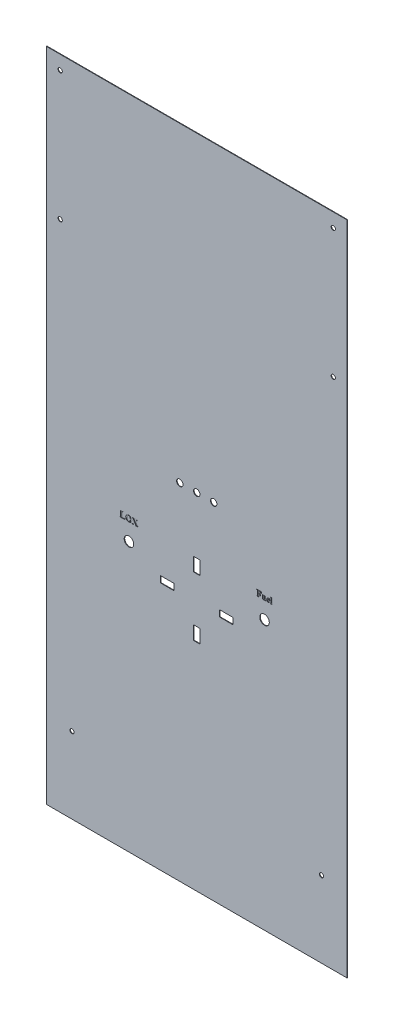
from build123d import *

# Parameters (mm, degrees)
SKETCH1_W           = 901.7
SKETCH1_H           = 1968.5
SKETCH1_R           = 6.35
BOSS_EXTRUDE1_DEPTH = 1.5875
SKETCH2_R           = 14.2875
SKETCH2_W           = 19.05
SKETCH2_H           = 40.64
SKETCH2_W_2         = 40.64
SKETCH2_H_2         = 19.05
CUT_EXTRUDE1_DEPTH  = 1083.597018819
WRAP1_START         = -3.81
WRAP1_DEPTH         = 1.27
SKETCH4_R           = 9.525
CUT_EXTRUDE4_DEPTH  = 22.86


# Read off the part's stored shape, not the designer's step: Wrap1
with BuildPart() as part:
    # Sketch1 → Boss-Extrude1 (new body)
    with BuildSketch(Plane.XY):
        Rectangle(SKETCH1_W, SKETCH1_H)
        with Locations((-409.447415534, 942.65240495)):
            Circle(SKETCH1_R, mode=Mode.SUBTRACT)
        with Locations((-409.447415534, 555.94759505)):
            Circle(SKETCH1_R, mode=Mode.SUBTRACT)
        with Locations((-374.018387972, -755.65)):
            Circle(SKETCH1_R, mode=Mode.SUBTRACT)
        with Locations(Location((374.018387972, -755.65, 0), (0, 0, 180))):
            Circle(SKETCH1_R, mode=Mode.SUBTRACT)
        with Locations(Location((409.447415534, 555.94759505, 0), (0, 0, 180))):
            Circle(SKETCH1_R, mode=Mode.SUBTRACT)
        with Locations(Location((409.447415534, 942.65240495, 0), (0, 0, 180))):
            Circle(SKETCH1_R, mode=Mode.SUBTRACT)
    extrude(amount=BOSS_EXTRUDE1_DEPTH)

    # Sketch2 → Cut-Extrude1 (cut, through all)
    with BuildSketch(Plane(origin=(0, 0, 0), x_dir=(-1, 0, 0), z_dir=(0, 0, -1))):
        with Locations((203.2, -177.8)):
            Circle(SKETCH2_R)
        with Locations((-203.2, -177.8)):
            Circle(SKETCH2_R)
        with Locations((0, -139.7)):
            Rectangle(SKETCH2_W, SKETCH2_H)
        with Locations((-88.9, -228.6)):
            Rectangle(SKETCH2_W_2, SKETCH2_H_2)
        with Locations((88.9, -228.6)):
            Rectangle(SKETCH2_W_2, SKETCH2_H_2)
        with Locations((0, -317.5)):
            Rectangle(SKETCH2_W, SKETCH2_H)
    extrude(amount=-CUT_EXTRUDE1_DEPTH, mode=Mode.SUBTRACT)

    # Wrap1 outline → Wrap1 (cut)
    # profile 1 of 7: a face of its own
    with BuildSketch(Plane.XY.offset(4.1275).offset(WRAP1_START)):
        with BuildLine():
            add(Edge.make_bspline(
                [(-229.753426043, -126.522165256), (-229.636237529, -126.519976219), (-229.41317649, -126.515809523), (-229.09617467, -126.466288885), (-228.813209456, -126.387863271), (-228.646163395, -126.304456099), (-228.566305351, -126.264582464)],
                knots=[0, 0, 0, 0, 0.286116983, 0.54460586, 0.782294265, 1, 1, 1, 1], degree=3))
            Line((-229.753426043, -126.522165256), (-230.317121718, -126.522165256))
            Line((-230.317121718, -126.522165256), (-230.317121718, -127))
            Line((-230.317121718, -127), (-215.265327284, -127))
            Line((-215.265327284, -127), (-214.548575168, -120.788148329))
            Line((-214.548575168, -120.788148329), (-215.026409912, -120.788148329))
            add(Edge.make_bspline(
                [(-220.151934157, -125.80541314), (-219.932562836, -125.800281899), (-219.510508502, -125.790409766), (-218.907320259, -125.698872442), (-218.358302074, -125.557162613), (-217.864370172, -125.344330626), (-217.414474169, -125.065851051), (-217.002301016, -124.717785385), (-216.620132883, -124.304052356), (-216.331879217, -123.906660058), (-216.11791995, -123.547865792), (-215.951997015, -123.245314942), (-215.794334863, -122.908249637), (-215.632393068, -122.54506771), (-215.481375396, -122.148092083), (-215.322503972, -121.724083219), (-215.171391707, -121.266497406), (-215.07550252, -120.950123175), (-215.026409912, -120.788148329)],
                knots=[0, 0, 0, 0, 0.083692486, 0.161018205, 0.232346257, 0.299586786, 0.365500353, 0.433621102, 0.504882686, 0.580041871, 0.620531465, 0.664319798, 0.71170201, 0.762539634, 0.816086004, 0.873798358, 0.935388254, 1, 1, 1, 1], degree=3))
            Line((-220.151934157, -125.80541314), (-221.585438389, -125.80541314))
            add(Edge.make_bspline(
                [(-223.119735887, -125.693420622), (-223.047852608, -125.711296101), (-222.870193417, -125.755475265), (-222.540067551, -125.779019781), (-222.101040503, -125.803347996), (-221.769696871, -125.804675129), (-221.585438389, -125.80541314)],
                knots=[0, 0, 0, 0, 0.143896066, 0.355638461, 0.641673878, 1, 1, 1, 1], degree=3))
            add(Edge.make_bspline(
                [(-223.866352675, -123.498367267), (-223.865392, -123.601652345), (-223.863551432, -123.799537588), (-223.856493191, -124.080826647), (-223.844815466, -124.333432834), (-223.832218453, -124.555332016), (-223.808811963, -124.748212218), (-223.783249281, -124.91138468), (-223.756011668, -125.047332218), (-223.70606115, -125.185917292), (-223.625445227, -125.332812904), (-223.491822327, -125.481418383), (-223.318626353, -125.601331533), (-223.187975318, -125.661824804), (-223.119735887, -125.693420622)],
                knots=[0, 0, 0, 0, 0.124219593, 0.237993955, 0.338360787, 0.42835088, 0.505199409, 0.571874059, 0.627062731, 0.671557261, 0.748594982, 0.82701569, 0.909649771, 1, 1, 1, 1], degree=3))
            Line((-223.866352675, -123.498367267), (-223.866352675, -112.664957682))
            add(Edge.make_bspline(
                [(-223.739427821, -111.119460932), (-223.749999809, -111.149146381), (-223.773852692, -111.216123714), (-223.798505966, -111.335239557), (-223.821268807, -111.483376173), (-223.833059635, -111.663254918), (-223.849289377, -111.87085995), (-223.861102616, -112.108602576), (-223.862236444, -112.376276017), (-223.864933293, -112.565412846), (-223.866352675, -112.664957682)],
                knots=[0, 0, 0, 0, 0.06067886, 0.136905735, 0.233920776, 0.349449884, 0.48411048, 0.635389887, 0.808101606, 1, 1, 1, 1], degree=3))
            add(Edge.make_bspline(
                [(-223.261593077, -110.533366754), (-223.310259198, -110.565232512), (-223.409867386, -110.630454278), (-223.538040862, -110.765996793), (-223.649286752, -110.930935983), (-223.708665918, -111.055124151), (-223.739427821, -111.119460932)],
                knots=[0, 0, 0, 0, 0.226387342, 0.463362038, 0.721989949, 1, 1, 1, 1], degree=3))
            add(Edge.make_bspline(
                [(-222.160333316, -110.275783963), (-222.268802824, -110.278119635), (-222.476986966, -110.28260246), (-222.772042924, -110.330870623), (-223.035001757, -110.410815629), (-223.188015126, -110.493572376), (-223.261593077, -110.533366754)],
                knots=[0, 0, 0, 0, 0.284002636, 0.54508263, 0.781248603, 1, 1, 1, 1], degree=3))
            Line((-222.160333316, -110.275783963), (-221.477178955, -110.275783963))
            Line((-221.477178955, -110.275783963), (-221.477178955, -109.797949219))
            Line((-221.477178955, -109.797949219), (-230.317121718, -109.797949219))
            Line((-230.317121718, -109.797949219), (-230.317121718, -110.275783963))
            Line((-230.317121718, -110.275783963), (-229.753426043, -110.275783963))
            add(Edge.make_bspline(
                [(-227.927947998, -112.664957682), (-227.929376487, -112.564168786), (-227.932110034, -112.371299754), (-227.933119221, -112.09740266), (-227.945249249, -111.853456485), (-227.960174603, -111.640682081), (-227.976466296, -111.455801376), (-228.004528872, -111.302130434), (-228.026816696, -111.175687487), (-228.073793401, -111.049072991), (-228.148610431, -110.910709437), (-228.275397871, -110.764872143), (-228.434574129, -110.630147904), (-228.626451322, -110.505917808), (-228.855303867, -110.400345023), (-229.122678716, -110.328270983), (-229.42585248, -110.282806886), (-229.64000416, -110.27821564), (-229.753426043, -110.275783963)],
                knots=[0, 0, 0, 0, 0.084622749, 0.161933587, 0.22990784, 0.289599081, 0.34105252, 0.385532842, 0.420773186, 0.448530112, 0.498553263, 0.551922288, 0.609709232, 0.67316662, 0.743282504, 0.820338844, 0.90484545, 1, 1, 1, 1], degree=3))
            Line((-227.927947998, -112.664957682), (-227.927947998, -124.132991536))
            add(Edge.make_bspline(
                [(-228.066072104, -125.678488286), (-228.053878904, -125.648919223), (-228.026103286, -125.581562086), (-228.005452117, -125.460770969), (-227.975507496, -125.313738641), (-227.960396653, -125.134824087), (-227.945152957, -124.925847451), (-227.933270797, -124.688097364), (-227.932024686, -124.420430161), (-227.929359829, -124.232536736), (-227.927947998, -124.132991536)],
                knots=[0, 0, 0, 0, 0.061394352, 0.139853863, 0.234760276, 0.350352995, 0.484827155, 0.638289672, 0.808367287, 1, 1, 1, 1], degree=3))
            add(Edge.make_bspline(
                [(-228.566305351, -126.264582464), (-228.513841635, -126.232933684), (-228.407719614, -126.168915485), (-228.271425976, -126.033307564), (-228.155927585, -125.868003182), (-228.096632758, -125.742944001), (-228.066072104, -125.678488286)],
                knots=[0, 0, 0, 0, 0.23335888, 0.472031298, 0.72788403, 1, 1, 1, 1], degree=3))
        make_face()
    # profile 2 of 7: a face of its own
    with BuildSketch(Plane.XY.offset(4.1275).offset(WRAP1_START)):
        with BuildLine():
            add(Edge.make_bspline(
                [(-194.718433295, -118.260850504), (-194.724017479, -118.527395433), (-194.735035576, -119.053312496), (-194.827203283, -119.829949656), (-194.977372559, -120.582130209), (-195.180608052, -121.312966858), (-195.451068619, -122.017123582), (-195.783231756, -122.69419378), (-196.164460973, -123.35329381), (-196.468850095, -123.762458061), (-196.622306103, -123.968735843)],
                knots=[0, 0, 0, 0, 0.130405832, 0.257302407, 0.382101033, 0.505478704, 0.628069418, 0.750625341, 0.874279213, 1, 1, 1, 1], degree=3))
            add(Edge.make_bspline(
                [(-203.909285948, -109.559031847), (-203.576856146, -109.553848597), (-202.926775912, -109.543712539), (-201.973128758, -109.637324107), (-201.066575694, -109.807149904), (-200.206609472, -110.059482945), (-199.398043873, -110.403407626), (-198.634697098, -110.827047087), (-197.919622082, -111.336565182), (-197.261501448, -111.926383685), (-196.66864867, -112.576115942), (-196.145231314, -113.269846968), (-195.70250353, -114.003776103), (-195.342394477, -114.778877827), (-195.06002235, -115.592766401), (-194.864971074, -116.447883307), (-194.741519452, -117.341405333), (-194.726223502, -117.950592369), (-194.718433295, -118.260850504)],
                knots=[0, 0, 0, 0, 0.069849949, 0.136594465, 0.20103729, 0.263531056, 0.324607527, 0.385387455, 0.446727247, 0.508796852, 0.570828957, 0.631365177, 0.691215795, 0.75067175, 0.810735822, 0.87197288, 0.934795961, 1, 1, 1, 1], degree=3))
            add(Edge.make_bspline(
                [(-212.876153564, -118.272049756), (-212.868157043, -117.961837627), (-212.852455997, -117.352740923), (-212.731856278, -116.457996138), (-212.525783502, -115.604326355), (-212.240446011, -114.788989394), (-211.87789791, -114.011937584), (-211.430577993, -113.276279528), (-210.899609784, -112.582201243), (-210.294740021, -111.934406847), (-209.633428736, -111.3455359), (-208.927659924, -110.831424373), (-208.1808215, -110.409611212), (-207.398487794, -110.06609697), (-206.578639267, -109.807869114), (-205.720070019, -109.63766039), (-204.82597401, -109.543972597), (-204.218086037, -109.553958913), (-203.909285948, -109.559031847)],
                knots=[0, 0, 0, 0, 0.066265956, 0.130112177, 0.192469093, 0.253598737, 0.314376421, 0.375339326, 0.437182314, 0.500765603, 0.564420002, 0.626110784, 0.686953563, 0.747315202, 0.808362113, 0.870201672, 0.934063944, 1, 1, 1, 1], degree=3))
            add(Edge.make_bspline(
                [(-210.882686742, -124.121792285), (-211.041964948, -123.914138898), (-211.358752432, -123.501138302), (-211.765029578, -122.838579483), (-212.106515122, -122.146758921), (-212.387202635, -121.427235156), (-212.608287484, -120.679395853), (-212.764464604, -119.902462731), (-212.860479239, -119.097003096), (-212.870876009, -118.549812049), (-212.876153564, -118.272049756)],
                knots=[0, 0, 0, 0, 0.124469297, 0.247556251, 0.369105337, 0.491161059, 0.614633392, 0.73970266, 0.867869208, 1, 1, 1, 1], degree=3))
            add(Edge.make_bspline(
                [(-203.745030255, -127.238917372), (-203.934245051, -127.237184516), (-204.308079424, -127.233760888), (-204.860990224, -127.193963899), (-205.39821356, -127.136256498), (-205.919316031, -127.05062999), (-206.422649041, -126.9359105), (-206.913431242, -126.809580948), (-207.38332404, -126.64672569), (-207.83756508, -126.462373568), (-208.278052534, -126.25912154), (-208.700899992, -126.027151484), (-209.104515854, -125.767855886), (-209.493225434, -125.487366165), (-209.868142157, -125.18574585), (-210.223166586, -124.854873643), (-210.563395068, -124.500787124), (-210.775787893, -124.248679752), (-210.882686742, -124.121792285)],
                knots=[0, 0, 0, 0, 0.070311969, 0.138916362, 0.205924571, 0.271084613, 0.335043637, 0.397754782, 0.459328336, 0.519703925, 0.579914551, 0.639525377, 0.698797951, 0.758099388, 0.817616847, 0.877506899, 0.938348334, 1, 1, 1, 1], degree=3))
            add(Edge.make_bspline(
                [(-196.622306103, -123.968735843), (-196.728949032, -124.102023109), (-196.940164733, -124.366010264), (-197.283101614, -124.734937967), (-197.635197756, -125.084869872), (-198.011845907, -125.40091671), (-198.399119001, -125.697042327), (-198.803860249, -125.967274303), (-199.225970337, -126.209236136), (-199.663398873, -126.426575744), (-200.117876159, -126.616624885), (-200.586542788, -126.786275217), (-201.075280584, -126.922569372), (-201.578199328, -127.039072591), (-202.097972362, -127.128677976), (-202.632721999, -127.190039728), (-203.183066067, -127.234871185), (-203.555792531, -127.237554845), (-203.745030255, -127.238917372)],
                knots=[0, 0, 0, 0, 0.062892078, 0.124563294, 0.185534769, 0.245726785, 0.305624548, 0.365154215, 0.424941259, 0.484831998, 0.54505371, 0.606415486, 0.668404777, 0.731930775, 0.796623147, 0.862668568, 0.930275174, 1, 1, 1, 1], degree=3))
        make_face()
        with BuildLine():
            add(Edge.make_bspline(
                [(-207.336257002, -112.877743467), (-207.418011601, -113.046803464), (-207.587222221, -113.396713404), (-207.782425416, -113.966883133), (-207.955597854, -114.586083402), (-208.096394776, -115.258230894), (-208.202657758, -115.983986359), (-208.279731821, -116.761310103), (-208.329848235, -117.590726366), (-208.334386685, -118.161225378), (-208.336723497, -118.454970868)],
                knots=[0, 0, 0, 0, 0.098492955, 0.203854633, 0.315738249, 0.435901004, 0.564024753, 0.700575662, 0.845828744, 1, 1, 1, 1], degree=3))
            add(Edge.make_bspline(
                [(-203.759962591, -110.514701335), (-203.950981852, -110.521329236), (-204.32403358, -110.534273219), (-204.864161608, -110.651635695), (-205.370511851, -110.832833113), (-205.839443614, -111.097103002), (-206.275888465, -111.429981496), (-206.669491416, -111.845337128), (-207.030434857, -112.329324537), (-207.232117168, -112.690993562), (-207.336257002, -112.877743467)],
                knots=[0, 0, 0, 0, 0.126292685, 0.246643735, 0.364165419, 0.481050344, 0.601480292, 0.726142767, 0.858592225, 1, 1, 1, 1], degree=3))
            add(Edge.make_bspline(
                [(-199.257863363, -118.555764135), (-199.260150236, -118.28570862), (-199.264577899, -117.762848584), (-199.294598316, -117.004720651), (-199.342354753, -116.298778745), (-199.408046938, -115.644744856), (-199.495249504, -115.0437181), (-199.610124055, -114.49664799), (-199.731670696, -113.999601347), (-199.883973099, -113.55448585), (-200.051568333, -113.153189474), (-200.220491672, -112.780337458), (-200.40937288, -112.442418253), (-200.600277353, -112.129008589), (-200.81201909, -111.85395378), (-201.027892107, -111.603286144), (-201.259982249, -111.387840569), (-201.578216058, -111.139023945), (-202.003960149, -110.884710985), (-202.557457648, -110.672459309), (-203.145997012, -110.53477257), (-203.552612772, -110.521479837), (-203.759962591, -110.514701335)],
                knots=[0, 0, 0, 0, 0.078235768, 0.15147388, 0.219769184, 0.283189358, 0.341871029, 0.39560353, 0.44509179, 0.490008293, 0.531715711, 0.571069594, 0.608500784, 0.643809453, 0.677264075, 0.708938794, 0.739545141, 0.768823346, 0.825888193, 0.882390021, 0.940025916, 1, 1, 1, 1], degree=3))
            add(Edge.make_bspline(
                [(-201.609706243, -125.659822867), (-201.518910442, -125.590370406), (-201.334389107, -125.449224443), (-201.075831196, -125.206206225), (-200.838968032, -124.92773117), (-200.61305054, -124.624253287), (-200.404645933, -124.290370142), (-200.209378265, -123.928329827), (-200.036400501, -123.533280409), (-199.869397069, -123.111498101), (-199.726283579, -122.655643678), (-199.596770806, -122.168011215), (-199.496883696, -121.645799464), (-199.404119426, -121.092516696), (-199.339843069, -120.505377496), (-199.289895411, -119.885502452), (-199.266084208, -119.231633965), (-199.260648465, -118.784738968), (-199.257863363, -118.555764135)],
                knots=[0, 0, 0, 0, 0.044242423, 0.089912429, 0.137048047, 0.185612229, 0.236272384, 0.289296534, 0.344719967, 0.403142498, 0.464849718, 0.529587621, 0.598372434, 0.670607157, 0.746741958, 0.826962138, 0.911340884, 1, 1, 1, 1], degree=3))
            add(Edge.make_bspline(
                [(-203.786094178, -126.283247884), (-203.577534203, -126.277488771), (-203.174112894, -126.266348815), (-202.597987697, -126.140658338), (-202.068139274, -125.953526382), (-201.760935203, -125.756710469), (-201.609706243, -125.659822867)],
                knots=[0, 0, 0, 0, 0.271629072, 0.525416998, 0.766374536, 1, 1, 1, 1], degree=3))
            add(Edge.make_bspline(
                [(-206.794959831, -124.838544401), (-206.703104717, -124.954220234), (-206.52357018, -125.180313328), (-206.21090486, -125.474389772), (-205.875288692, -125.728431585), (-205.505384156, -125.927398468), (-205.115500528, -126.09224697), (-204.695677531, -126.202467996), (-204.250044979, -126.271235548), (-203.943147012, -126.279181566), (-203.786094178, -126.283247884)],
                knots=[0, 0, 0, 0, 0.12750736, 0.249218294, 0.369884192, 0.490218952, 0.611248533, 0.734906211, 0.864340154, 1, 1, 1, 1], degree=3))
            add(Edge.make_bspline(
                [(-208.336723497, -118.454970868), (-208.333476883, -118.803555521), (-208.327195784, -119.477948657), (-208.249358748, -120.453508534), (-208.133703357, -121.359168115), (-207.967016958, -122.194241479), (-207.751395889, -122.960169556), (-207.48801407, -123.655909283), (-207.176706047, -124.284764584), (-206.920066783, -124.657058109), (-206.794959831, -124.838544401)],
                knots=[0, 0, 0, 0, 0.156670188, 0.303103704, 0.439658844, 0.566921389, 0.685563365, 0.796936138, 0.901010077, 1, 1, 1, 1], degree=3))
        make_face(mode=Mode.SUBTRACT)
    # profile 3 of 7: a face of its own
    with BuildSketch(Plane.XY.offset(4.1275).offset(WRAP1_START)):
        with BuildLine():
            add(Edge.make_bspline(
                [(-178.315262477, -123.901540332), (-178.220954099, -124.042332192), (-178.040973638, -124.311022891), (-177.780417607, -124.691101697), (-177.542567801, -125.028886613), (-177.321117656, -125.319631326), (-177.124841845, -125.569878388), (-176.950043375, -125.777286062), (-176.794414717, -125.938631232), (-176.614360473, -126.095060742), (-176.388000485, -126.240639613), (-176.102705495, -126.377493649), (-175.792360898, -126.470692124), (-175.576923504, -126.504766569), (-175.466919433, -126.522165256)],
                knots=[0, 0, 0, 0, 0.126497608, 0.241411193, 0.343994715, 0.434841881, 0.514196246, 0.581398797, 0.637233328, 0.681363404, 0.759169511, 0.837285515, 0.916916671, 1, 1, 1, 1], degree=3))
            Line((-178.315262477, -123.901540332), (-182.847226376, -117.058797476))
            Line((-182.847226376, -117.058797476), (-179.67410503, -113.116660839))
            add(Edge.make_bspline(
                [(-178.035281181, -111.138126352), (-178.067911162, -111.171467294), (-178.144929118, -111.250163361), (-178.270668934, -111.394301992), (-178.43270684, -111.576080202), (-178.621005906, -111.804397521), (-178.841537657, -112.072940804), (-179.091408658, -112.383005643), (-179.372355461, -112.735384894), (-179.569662217, -112.984692027), (-179.67410503, -113.116660839)],
                knots=[0, 0, 0, 0, 0.054447391, 0.128514533, 0.223210912, 0.338706703, 0.473921181, 0.62886415, 0.803542095, 1, 1, 1, 1], degree=3))
            add(Edge.make_bspline(
                [(-175.870092498, -110.275783963), (-175.988388839, -110.28054247), (-176.213111938, -110.289582027), (-176.53193173, -110.325021943), (-176.814061909, -110.385280788), (-177.069543497, -110.463935091), (-177.309766105, -110.576399345), (-177.5452197, -110.730779986), (-177.792284414, -110.916455595), (-177.951864525, -111.062030552), (-178.035281181, -111.138126352)],
                knots=[0, 0, 0, 0, 0.147897503, 0.280955311, 0.400178886, 0.507855505, 0.614267687, 0.73028563, 0.859013314, 1, 1, 1, 1], degree=3))
            Line((-175.870092498, -110.275783963), (-175.870092498, -109.797949219))
            Line((-175.870092498, -109.797949219), (-182.283530702, -109.797949219))
            Line((-182.283530702, -109.797949219), (-182.283530702, -110.275783963))
            add(Edge.make_bspline(
                [(-180.394590229, -111.526367082), (-180.403774393, -111.415123672), (-180.422240277, -111.191455202), (-180.57988662, -110.882221614), (-180.818105816, -110.61362874), (-181.096798512, -110.451322452), (-181.369936212, -110.360529529), (-181.630665232, -110.309534589), (-181.94074642, -110.282292916), (-182.16401731, -110.278053341), (-182.283530702, -110.275783963)],
                knots=[0, 0, 0, 0, 0.130173209, 0.261729146, 0.399541564, 0.547861549, 0.634397953, 0.737427191, 0.859448911, 1, 1, 1, 1], degree=3))
            add(Edge.make_bspline(
                [(-181.77956437, -113.919273885), (-181.670165064, -113.783270081), (-181.462006767, -113.524490375), (-181.183403562, -113.142693233), (-180.942598204, -112.797280643), (-180.746913136, -112.482078866), (-180.592210352, -112.200149806), (-180.481139557, -111.948754979), (-180.412179484, -111.727798585), (-180.400053988, -111.588937844), (-180.394590229, -111.526367082)],
                knots=[0, 0, 0, 0, 0.187080214, 0.355964768, 0.50655841, 0.638342089, 0.753533152, 0.850920003, 0.932824433, 1, 1, 1, 1], degree=3))
            Line((-181.77956437, -113.919273885), (-183.504249149, -116.062064065))
            Line((-183.504249149, -116.062064065), (-185.609708489, -112.885209635))
            Line((-185.609708489, -112.885209635), (-186.479517047, -111.574897173))
            add(Edge.make_bspline(
                [(-186.565377977, -111.093329345), (-186.562378123, -111.181261317), (-186.556756568, -111.34604082), (-186.504082454, -111.502111254), (-186.479517047, -111.574897173)],
                knots=[0, 0, 0, 0, 0.533634166, 1, 1, 1, 1], degree=3))
            add(Edge.make_bspline(
                [(-185.258798599, -110.275783963), (-185.37104042, -110.27798624), (-185.579143812, -110.282069401), (-185.863294114, -110.327280866), (-186.098857514, -110.391690812), (-186.275812465, -110.500759486), (-186.407129066, -110.626867808), (-186.500166643, -110.768269442), (-186.554446759, -110.926544536), (-186.561681095, -111.036923576), (-186.565377977, -111.093329345)],
                knots=[0, 0, 0, 0, 0.193798871, 0.359315288, 0.49675642, 0.612601935, 0.714528736, 0.809401167, 0.902600404, 1, 1, 1, 1], degree=3))
            Line((-185.258798599, -110.275783963), (-184.829493946, -110.275783963))
            Line((-184.829493946, -110.275783963), (-184.829493946, -109.797949219))
            Line((-184.829493946, -109.797949219), (-193.221466637, -109.797949219))
            Line((-193.221466637, -109.797949219), (-193.221466637, -110.275783963))
            add(Edge.make_bspline(
                [(-191.646105215, -111.134393268), (-191.700723502, -111.068399346), (-191.804776639, -110.94267452), (-191.976203892, -110.781825301), (-192.140999932, -110.645457869), (-192.314779915, -110.541253063), (-192.499368964, -110.450303007), (-192.714520602, -110.384128408), (-192.956368151, -110.317695745), (-193.130245394, -110.290205942), (-193.221466637, -110.275783963)],
                knots=[0, 0, 0, 0, 0.138951375, 0.264715855, 0.381158651, 0.485468856, 0.593016643, 0.714420306, 0.850176286, 1, 1, 1, 1], degree=3))
            add(Edge.make_bspline(
                [(-190.425386768, -112.892675802), (-190.510008736, -112.76824351), (-190.66916105, -112.53421814), (-190.893644324, -112.203950584), (-191.090125143, -111.919755069), (-191.2558718, -111.677666631), (-191.393563225, -111.479483765), (-191.504256651, -111.326045529), (-191.583346182, -111.213936229), (-191.628526414, -111.156673246), (-191.646105215, -111.134393268)],
                knots=[0, 0, 0, 0, 0.210884309, 0.396619539, 0.559630646, 0.695069056, 0.807787606, 0.897795021, 0.960233914, 1, 1, 1, 1], degree=3))
            Line((-190.425386768, -112.892675802), (-186.15100566, -119.347177929))
            Line((-186.15100566, -119.347177929), (-189.484649616, -123.487168015))
            add(Edge.make_bspline(
                [(-191.84022558, -125.913672574), (-191.766050175, -125.859885825), (-191.606062475, -125.743874079), (-191.366058271, -125.535878004), (-191.099990605, -125.294138782), (-190.816694507, -125.0094193), (-190.515967961, -124.681894349), (-190.185947113, -124.322032296), (-189.840526286, -123.918365216), (-189.606143705, -123.634376066), (-189.484649616, -123.487168015)],
                knots=[0, 0, 0, 0, 0.081036263, 0.17478577, 0.280771193, 0.39911038, 0.529989712, 0.674191297, 0.831114449, 1, 1, 1, 1], degree=3))
            add(Edge.make_bspline(
                [(-193.605974282, -126.522165256), (-193.428475542, -126.492064393), (-193.090058547, -126.434674445), (-192.617066321, -126.297633403), (-192.196800775, -126.137494655), (-191.955258099, -125.985878432), (-191.84022558, -125.913672574)],
                knots=[0, 0, 0, 0, 0.286640828, 0.546506005, 0.784027577, 1, 1, 1, 1], degree=3))
            Line((-193.605974282, -126.522165256), (-193.605974282, -127))
            Line((-193.605974282, -127), (-186.901355531, -127))
            Line((-186.901355531, -127), (-186.901355531, -126.522165256))
            add(Edge.make_bspline(
                [(-187.983949873, -126.451236661), (-187.92808433, -126.462106428), (-187.794865981, -126.488026741), (-187.557390939, -126.506108324), (-187.252494845, -126.5219491), (-187.025831792, -126.52208863), (-186.901355531, -126.522165256)],
                knots=[0, 0, 0, 0, 0.157013586, 0.374418457, 0.65645018, 1, 1, 1, 1], degree=3))
            add(Edge.make_bspline(
                [(-189.182269817, -125.357443068), (-189.178851806, -125.416422899), (-189.172072093, -125.53341092), (-189.110462365, -125.705148863), (-189.013051414, -125.867543086), (-188.879299513, -126.022595825), (-188.710655866, -126.166853091), (-188.499640293, -126.282553785), (-188.255487944, -126.382385117), (-188.078006956, -126.427387426), (-187.983949873, -126.451236661)],
                knots=[0, 0, 0, 0, 0.100751351, 0.199842915, 0.30878505, 0.423694858, 0.549243335, 0.686728538, 0.833979966, 1, 1, 1, 1], degree=3))
            add(Edge.make_bspline(
                [(-188.010081461, -123.468502596), (-188.103204143, -123.578415982), (-188.279522639, -123.786526001), (-188.514294387, -124.09516081), (-188.716886225, -124.372651741), (-188.880348063, -124.624214005), (-189.016057474, -124.842408939), (-189.104691846, -125.038941749), (-189.167747871, -125.205610863), (-189.177829475, -125.311017685), (-189.182269817, -125.357443068)],
                knots=[0, 0, 0, 0, 0.192150646, 0.363818055, 0.517241748, 0.650310056, 0.764194402, 0.859271298, 0.938017447, 1, 1, 1, 1], degree=3))
            Line((-188.010081461, -123.468502596), (-185.493982887, -120.340178257))
            Line((-185.493982887, -120.340178257), (-183.175737762, -123.841810989))
            add(Edge.make_bspline(
                [(-182.294729953, -125.256649801), (-182.333521799, -125.178930532), (-182.426187099, -124.993276065), (-182.619758612, -124.684435407), (-182.871831428, -124.288855042), (-183.067842083, -124.000524766), (-183.175737762, -123.841810989)],
                knots=[0, 0, 0, 0, 0.156153027, 0.373015693, 0.654871322, 1, 1, 1, 1], degree=3))
            add(Edge.make_bspline(
                [(-182.208869023, -125.663555951), (-182.212308373, -125.590514532), (-182.218918647, -125.450132254), (-182.270153016, -125.319374036), (-182.294729953, -125.256649801)],
                knots=[0, 0, 0, 0, 0.520303695, 1, 1, 1, 1], degree=3))
            add(Edge.make_bspline(
                [(-183.78049736, -126.522165256), (-183.62973452, -126.507746945), (-183.3557518, -126.481544413), (-182.988379234, -126.422634598), (-182.706918014, -126.34236816), (-182.505315768, -126.234799413), (-182.371657244, -126.106352373), (-182.274562777, -125.9723012), (-182.220308703, -125.820433904), (-182.212708266, -125.716205383), (-182.208869023, -125.663555951)],
                knots=[0, 0, 0, 0, 0.22952437, 0.417116787, 0.563269803, 0.671351673, 0.759411843, 0.842075566, 0.920226904, 1, 1, 1, 1], degree=3))
            Line((-183.78049736, -126.522165256), (-183.78049736, -127))
            Line((-183.78049736, -127), (-175.466919433, -127))
            Line((-175.466919433, -127), (-175.466919433, -126.522165256))
        make_face()
    # profile 4 of 7: a face of its own
    with BuildSketch(Plane.XY.offset(4.1275).offset(WRAP1_START)):
        with BuildLine():
            add(Edge.make_bspline(
                [(225.897150336, -124.371908908), (225.89779293, -124.478935376), (225.899018732, -124.683097566), (225.910148184, -124.974412762), (225.928150444, -125.235967251), (225.953767852, -125.466429096), (225.985672624, -125.667875825), (226.030754716, -125.836986712), (226.077542972, -125.978284731), (226.152056385, -126.125592134), (226.286821706, -126.274708238), (226.505716323, -126.402368284), (226.780484112, -126.485826486), (226.982878765, -126.509456044), (227.091737196, -126.522165256)],
                knots=[0, 0, 0, 0, 0.113303814, 0.216136768, 0.308589519, 0.390787078, 0.461608663, 0.524237009, 0.575901825, 0.618914388, 0.6982322, 0.78453931, 0.884113971, 1, 1, 1, 1], degree=3))
            Line((225.897150336, -124.371908908), (225.897150336, -109.797949219))
            Line((225.897150336, -109.797949219), (221.118802897, -109.797949219))
            Line((221.118802897, -109.797949219), (221.118802897, -110.275783963))
            add(Edge.make_bspline(
                [(222.313389757, -112.42604031), (222.312711865, -112.319019474), (222.311418729, -112.114868025), (222.300788763, -111.824721152), (222.281474139, -111.564634085), (222.258992353, -111.33456812), (222.218104833, -111.135078672), (222.18235245, -110.963141627), (222.128237881, -110.824214327), (222.055408195, -110.675778042), (221.91875454, -110.527441679), (221.703421231, -110.395520993), (221.428802406, -110.3118181), (221.227634815, -110.288434512), (221.118802897, -110.275783963)],
                knots=[0, 0, 0, 0, 0.113475465, 0.216464207, 0.307741029, 0.390063115, 0.461224767, 0.523628009, 0.575823302, 0.618901027, 0.698339003, 0.785468901, 0.883938407, 1, 1, 1, 1], degree=3))
            Line((222.313389757, -112.42604031), (222.313389757, -124.371908908))
            add(Edge.make_bspline(
                [(222.100603973, -126.03313126), (222.117659052, -126.002426672), (222.156537167, -125.93243365), (222.199031444, -125.803696314), (222.235040733, -125.643622125), (222.264353755, -125.451474495), (222.286208578, -125.227171483), (222.299234716, -124.970542076), (222.311920293, -124.681873132), (222.31288234, -124.478941952), (222.313389757, -124.371908908)],
                knots=[0, 0, 0, 0, 0.062274042, 0.141957556, 0.239524505, 0.353613935, 0.486876676, 0.639624286, 0.809925169, 1, 1, 1, 1], degree=3))
            add(Edge.make_bspline(
                [(221.118802897, -126.522165256), (221.222937791, -126.512967248), (221.420694176, -126.495499859), (221.694726847, -126.399501839), (221.929352913, -126.247804202), (222.043116973, -126.105194483), (222.100603973, -126.03313126)],
                knots=[0, 0, 0, 0, 0.274716901, 0.521698533, 0.75830578, 1, 1, 1, 1], degree=3))
            Line((221.118802897, -126.522165256), (221.118802897, -127))
            Line((221.118802897, -127), (227.091737196, -127))
            Line((227.091737196, -127), (227.091737196, -126.522165256))
        make_face()
    # profile 5 of 7: a face of its own
    with BuildSketch(Plane.XY.offset(4.1275).offset(WRAP1_START)):
        with BuildLine():
            add(Edge.make_bspline(
                [(213.473446994, -120.788148329), (213.484435832, -120.960148917), (213.505943609, -121.29679511), (213.583114555, -121.786676721), (213.684978238, -122.249040656), (213.821703415, -122.682893581), (213.983799397, -123.090003948), (214.180318154, -123.468878969), (214.401634918, -123.824018593), (214.579570657, -124.035377647), (214.668033854, -124.140457704)],
                knots=[0, 0, 0, 0, 0.142498601, 0.278903765, 0.409754711, 0.533792625, 0.654786412, 0.771718901, 0.886506916, 1, 1, 1, 1], degree=3))
            Line((213.473446994, -120.788148329), (219.685298665, -120.788148329))
            add(Edge.make_bspline(
                [(215.186932521, -115.054131402), (215.332744169, -115.058510463), (215.622200037, -115.067203493), (216.048806762, -115.134412784), (216.458018259, -115.253112742), (216.855015559, -115.409736193), (217.234216931, -115.616447449), (217.601105015, -115.865873655), (217.951321342, -116.161091595), (218.283547274, -116.50245011), (218.594544826, -116.883472124), (218.86336233, -117.315423435), (219.099552053, -117.785633618), (219.293677172, -118.302842174), (219.448696858, -118.86284987), (219.567373822, -119.466872314), (219.649949143, -120.112981811), (219.673298611, -120.558950461), (219.685298665, -120.788148329)],
                knots=[0, 0, 0, 0, 0.053851778, 0.106903072, 0.158993774, 0.210976872, 0.264244788, 0.318174982, 0.374616845, 0.433126587, 0.493931417, 0.555909881, 0.620664302, 0.688022464, 0.759624451, 0.835078572, 0.915241487, 1, 1, 1, 1], degree=3))
            add(Edge.make_bspline(
                [(209.889686415, -121.336911668), (209.894719185, -121.10276357), (209.90454369, -120.645681529), (209.980594115, -119.978999285), (210.102613191, -119.349353239), (210.2741664, -118.754968824), (210.497535894, -118.198065108), (210.772958134, -117.678469985), (211.094379424, -117.194692575), (211.463511022, -116.751469289), (211.868601015, -116.356868909), (212.289861517, -116.006538666), (212.730381362, -115.712693562), (213.188089446, -115.471799928), (213.664038535, -115.28490749), (214.156563033, -115.148604378), (214.666675717, -115.069113443), (215.012450108, -115.059156041), (215.186932521, -115.054131402)],
                knots=[0, 0, 0, 0, 0.076562623, 0.149458401, 0.21913521, 0.286105541, 0.351475226, 0.415010164, 0.478105644, 0.541102612, 0.603263254, 0.662822278, 0.720048412, 0.77611527, 0.831661283, 0.886950275, 0.942953587, 1, 1, 1, 1], degree=3))
            add(Edge.make_bspline(
                [(210.968547673, -125.271582137), (210.88102663, -125.137625359), (210.705153318, -124.868439554), (210.492613936, -124.431055744), (210.303414385, -123.974618269), (210.150153402, -123.492736846), (210.037104595, -122.986250765), (209.948583271, -122.458223958), (209.902174638, -121.905168811), (209.893899387, -121.528616399), (209.889686415, -121.336911668)],
                knots=[0, 0, 0, 0, 0.115803047, 0.23270593, 0.351552617, 0.473563527, 0.598418097, 0.72719374, 0.861112958, 1, 1, 1, 1], degree=3))
            add(Edge.make_bspline(
                [(214.914417394, -127.238917372), (214.703729756, -127.233864665), (214.292610381, -127.224005208), (213.696785522, -127.127513253), (213.13887858, -126.977069211), (212.622985722, -126.757196627), (212.145015008, -126.480466919), (211.707965539, -126.139364108), (211.30691038, -125.738898373), (211.082697561, -125.429235729), (210.968547673, -125.271582137)],
                knots=[0, 0, 0, 0, 0.137204424, 0.267729979, 0.392271254, 0.512917972, 0.632116942, 0.751180664, 0.873322589, 1, 1, 1, 1], degree=3))
            add(Edge.make_bspline(
                [(219.685298665, -123.416239421), (219.605780294, -123.584895446), (219.451712401, -123.911668717), (219.204794229, -124.376907407), (218.950341491, -124.801946302), (218.694303997, -125.193874332), (218.424581023, -125.543359165), (218.15255458, -125.859695507), (217.873300421, -126.136028928), (217.586567255, -126.375587228), (217.288999838, -126.576118976), (216.984868778, -126.755089568), (216.667742744, -126.902249872), (216.340858213, -127.028855322), (216.000030954, -127.120331824), (215.648204292, -127.18765311), (215.285001608, -127.229779755), (215.038965215, -127.235846355), (214.914417394, -127.238917372)],
                knots=[0, 0, 0, 0, 0.085828138, 0.166293149, 0.242330062, 0.313823047, 0.381648941, 0.445397375, 0.505750891, 0.562298265, 0.617113102, 0.670757122, 0.724569091, 0.777869471, 0.831927831, 0.886751647, 0.942671751, 1, 1, 1, 1], degree=3))
            Line((219.685298665, -123.416239421), (219.255994013, -123.177322049))
            add(Edge.make_bspline(
                [(216.672699928, -125.088661024), (216.791421251, -125.083974405), (217.025324331, -125.074740892), (217.365670203, -124.991010226), (217.691516567, -124.865737813), (218.002764023, -124.673953047), (218.310747805, -124.415701638), (218.624350768, -124.079404838), (218.942669548, -123.658350097), (219.14729079, -123.344207513), (219.255994013, -123.177322049)],
                knots=[0, 0, 0, 0, 0.105424729, 0.207706318, 0.31005375, 0.414825833, 0.531164543, 0.666607217, 0.822888038, 1, 1, 1, 1], degree=3))
            add(Edge.make_bspline(
                [(214.668033854, -124.140457704), (214.737224099, -124.216910611), (214.87225015, -124.36610988), (215.100832508, -124.556095409), (215.334102487, -124.723587943), (215.583593361, -124.852302243), (215.839535799, -124.960699447), (216.10831747, -125.033406274), (216.387327271, -125.080545548), (216.576688627, -125.085930639), (216.672699928, -125.088661024)],
                knots=[0, 0, 0, 0, 0.134919963, 0.263298817, 0.388576173, 0.510368139, 0.630257589, 0.752082285, 0.87429905, 1, 1, 1, 1], degree=3))
        make_face()
        with BuildLine():
            add(Edge.make_bspline(
                [(215.758094364, -116.21885359), (215.715890545, -116.185464945), (215.631040376, -116.118337554), (215.474479544, -116.057257161), (215.302645961, -116.013317442), (215.179795928, -116.011002805), (215.116003927, -116.00980089)],
                knots=[0, 0, 0, 0, 0.232672174, 0.467784049, 0.723637675, 1, 1, 1, 1], degree=3))
            add(Edge.make_bspline(
                [(216.57937283, -119.832478841), (216.57815544, -119.683164175), (216.575821963, -119.396959862), (216.572034655, -118.984794933), (216.54875463, -118.609325407), (216.535561247, -118.270170354), (216.502716886, -117.96930557), (216.470920622, -117.703778395), (216.432081819, -117.47387069), (216.367082665, -117.223662081), (216.275295191, -116.951215735), (216.135391836, -116.663950962), (215.965533996, -116.416189083), (215.826465873, -116.283894804), (215.758094364, -116.21885359)],
                knots=[0, 0, 0, 0, 0.117461895, 0.225149355, 0.32413075, 0.413337278, 0.492033041, 0.562085029, 0.623719301, 0.675235114, 0.765312701, 0.849359813, 0.925939196, 1, 1, 1, 1], degree=3))
            Line((216.57937283, -119.832478841), (213.473446994, -119.832478841))
            Line((213.473446994, -119.832478841), (213.473446994, -119.425572692))
            add(Edge.make_bspline(
                [(214.145402103, -116.599628152), (214.091434461, -116.688287968), (213.980986667, -116.869735237), (213.844736112, -117.165381535), (213.728537195, -117.483751515), (213.636225129, -117.826357975), (213.561311693, -118.19146538), (213.509581338, -118.581886146), (213.480528455, -118.995820581), (213.475846785, -119.279936775), (213.473446994, -119.425572692)],
                knots=[0, 0, 0, 0, 0.105683126, 0.216286423, 0.330999153, 0.450650361, 0.577463014, 0.710511166, 0.851610106, 1, 1, 1, 1], degree=3))
            add(Edge.make_bspline(
                [(215.116003927, -116.00980089), (215.020260492, -116.016772573), (214.83218273, -116.030467701), (214.565365604, -116.148259392), (214.329499766, -116.339846718), (214.208686654, -116.510326903), (214.145402103, -116.599628152)],
                knots=[0, 0, 0, 0, 0.241168632, 0.473750048, 0.724338765, 1, 1, 1, 1], degree=3))
        make_face(mode=Mode.SUBTRACT)
    # profile 6 of 7: a face of its own
    with BuildSketch(Plane.XY.offset(4.1275).offset(WRAP1_START)):
        with BuildLine():
            add(Edge.make_bspline(
                [(206.783760579, -124.371908908), (206.784395331, -124.481422313), (206.785600291, -124.689313397), (206.796716774, -124.98562686), (206.814858649, -125.249598645), (206.839487333, -125.481578661), (206.874699328, -125.680382411), (206.908140845, -125.849243391), (206.956107465, -125.984974566), (207.031210314, -126.124276012), (207.170474694, -126.25992339), (207.387587762, -126.383262682), (207.662881164, -126.474804773), (207.868148551, -126.505621261), (207.978347439, -126.522165256)],
                knots=[0, 0, 0, 0, 0.116020453, 0.220243522, 0.314076703, 0.396332412, 0.467204098, 0.527976068, 0.578435535, 0.619154622, 0.694668533, 0.780359926, 0.882085058, 1, 1, 1, 1], degree=3))
            Line((206.783760579, -124.371908908), (206.783760579, -115.293048774))
            Line((206.783760579, -115.293048774), (202.00541314, -115.293048774))
            Line((202.00541314, -115.293048774), (202.00541314, -115.770883518))
            add(Edge.make_bspline(
                [(203.2, -117.921139865), (203.199305079, -117.81163153), (203.197985899, -117.603750069), (203.187677488, -117.308613101), (203.167253485, -117.046210669), (203.148921221, -116.816286749), (203.113921953, -116.618234257), (203.074152161, -116.453668371), (203.031530681, -116.31754321), (202.956042568, -116.181060606), (202.820065788, -116.043443893), (202.60464931, -115.916301083), (202.325177344, -115.826497773), (202.117978104, -115.790461121), (202.00541314, -115.770883518)],
                knots=[0, 0, 0, 0, 0.116169972, 0.220527356, 0.313164742, 0.395388824, 0.465050798, 0.526201019, 0.575042058, 0.615813621, 0.690509018, 0.77698849, 0.878844718, 1, 1, 1, 1], degree=3))
            Line((203.2, -117.921139865), (203.2, -124.237517887))
            add(Edge.make_bspline(
                [(202.091274071, -125.566495768), (202.174168154, -125.500185334), (202.359746653, -125.351733352), (202.618448108, -125.051194896), (202.912171947, -124.679578898), (203.099173586, -124.392372239), (203.2, -124.237517887)],
                knots=[0, 0, 0, 0, 0.182785657, 0.409210003, 0.681461416, 1, 1, 1, 1], degree=3))
            add(Edge.make_bspline(
                [(201.337191115, -125.80541314), (201.405906056, -125.802690298), (201.541119666, -125.797332435), (201.737527339, -125.750398248), (201.923789255, -125.676431443), (202.035123548, -125.603352516), (202.091274071, -125.566495768)],
                knots=[0, 0, 0, 0, 0.256146427, 0.504031335, 0.749862335, 1, 1, 1, 1], degree=3))
            add(Edge.make_bspline(
                [(200.332991536, -123.416239421), (200.334563848, -123.609112963), (200.33740506, -123.957641112), (200.353207655, -124.423695093), (200.383795475, -124.777918677), (200.428600591, -125.03642746), (200.501057154, -125.224236772), (200.575624313, -125.379730475), (200.676959184, -125.506762863), (200.817296813, -125.652791125), (201.041677323, -125.776861321), (201.238560088, -125.795883652), (201.337191115, -125.80541314)],
                knots=[0, 0, 0, 0, 0.199348445, 0.360228488, 0.481666427, 0.566912627, 0.629979681, 0.689220041, 0.744263756, 0.797005927, 0.898307431, 1, 1, 1, 1], degree=3))
            Line((200.332991536, -123.416239421), (200.332991536, -115.293048774))
            Line((200.332991536, -115.293048774), (195.554644097, -115.293048774))
            Line((195.554644097, -115.293048774), (195.554644097, -115.770883518))
            add(Edge.make_bspline(
                [(196.749230957, -117.921139865), (196.748536036, -117.81163153), (196.747216856, -117.603750069), (196.736908445, -117.308613101), (196.716484442, -117.046210669), (196.698152178, -116.816286749), (196.66315291, -116.618234257), (196.623383118, -116.453668371), (196.580761638, -116.31754321), (196.505273525, -116.181060606), (196.369296745, -116.043443893), (196.153880267, -115.916301083), (195.874408301, -115.826497773), (195.667209061, -115.790461121), (195.554644097, -115.770883518)],
                knots=[0, 0, 0, 0, 0.116169972, 0.220527356, 0.313164742, 0.395388824, 0.465050798, 0.526201019, 0.575042058, 0.615813621, 0.690509018, 0.77698849, 0.878844718, 1, 1, 1, 1], degree=3))
            Line((196.749230957, -117.921139865), (196.749230957, -122.468036101))
            add(Edge.make_bspline(
                [(199.731965023, -127.238917372), (199.574450382, -127.232085326), (199.263998307, -127.218619767), (198.814905916, -127.101348143), (198.390881884, -126.916256375), (198.006341292, -126.655549568), (197.666138045, -126.347710182), (197.377250195, -126.010835987), (197.15593907, -125.644107303), (197.016184065, -125.315925275), (196.937954288, -125.024561219), (196.886111458, -124.769069793), (196.847860462, -124.474366357), (196.808296033, -124.144937171), (196.785905934, -123.777205499), (196.760707047, -123.374239053), (196.75161589, -122.933464828), (196.750047115, -122.627312512), (196.749230957, -122.468036101)],
                knots=[0, 0, 0, 0, 0.073706266, 0.145270708, 0.216025163, 0.289613689, 0.36186854, 0.430559966, 0.496765889, 0.561852933, 0.59693819, 0.637994494, 0.683929235, 0.73615498, 0.793447977, 0.856523856, 0.925356223, 1, 1, 1, 1], degree=3))
            add(Edge.make_bspline(
                [(203.2, -125.424638579), (203.06595107, -125.582794182), (202.810615825, -125.884047611), (202.399047994, -126.276474217), (201.990476897, -126.598034205), (201.571338387, -126.842790192), (201.140440278, -127.019702058), (200.692647179, -127.148548154), (200.219779811, -127.223449933), (199.896481662, -127.233700943), (199.731965023, -127.238917372)],
                knots=[0, 0, 0, 0, 0.152850907, 0.29114909, 0.418761231, 0.535586322, 0.647932721, 0.761543386, 0.878656649, 1, 1, 1, 1], degree=3))
            Line((203.2, -125.424638579), (203.2, -127))
            Line((203.2, -127), (207.978347439, -127))
            Line((207.978347439, -127), (207.978347439, -126.522165256))
        make_face()
    # profile 7 of 7: a face of its own
    with BuildSketch(Plane.XY.offset(4.1275).offset(WRAP1_START)):
        with BuildLine():
            add(Edge.make_bspline(
                [(186.475783963, -117.682222493), (186.650254704, -117.678657999), (186.983378702, -117.671852165), (187.458634767, -117.600656413), (187.883080829, -117.482524367), (188.264204856, -117.316630361), (188.605632982, -117.088620321), (188.915513057, -116.799955045), (189.193835836, -116.443673836), (189.449285584, -116.02720192), (189.670166659, -115.536315637), (189.847791253, -114.967537753), (189.979776588, -114.320544081), (190.032113919, -113.861314768), (190.059544542, -113.62062717)],
                knots=[0, 0, 0, 0, 0.085711886, 0.163653148, 0.23548944, 0.301755796, 0.367069612, 0.436320393, 0.5090161, 0.588638511, 0.675961237, 0.772877052, 0.880962136, 1, 1, 1, 1], degree=3))
            Line((186.475783963, -117.682222493), (185.997949219, -117.682222493))
            Line((185.997949219, -117.682222493), (185.997949219, -110.992536079))
            Line((185.997949219, -110.992536079), (187.670370822, -110.992536079))
            add(Edge.make_bspline(
                [(190.43658602, -111.186656443), (190.368281418, -111.171058377), (190.218790583, -111.136920589), (189.972068262, -111.096888096), (189.685530122, -111.064061546), (189.359165129, -111.039453606), (188.993377978, -111.016141724), (188.587566261, -111.001990915), (188.142005799, -110.995475393), (187.832139682, -110.993544251), (187.670370822, -110.992536079)],
                knots=[0, 0, 0, 0, 0.075634617, 0.16553324, 0.269692222, 0.386960346, 0.518876508, 0.665423944, 0.825331057, 1, 1, 1, 1], degree=3))
            add(Edge.make_bspline(
                [(193.40438775, -115.054131402), (193.388669256, -114.909552949), (193.358198612, -114.629284456), (193.286034461, -114.225855791), (193.200287, -113.850786298), (193.101337579, -113.503124264), (192.982314378, -113.184329689), (192.843771932, -112.896354522), (192.690404248, -112.63537032), (192.460945963, -112.326316933), (192.118111565, -111.987343003), (191.631933844, -111.64807411), (191.065766681, -111.37309847), (190.651535582, -111.250351395), (190.43658602, -111.186656443)],
                knots=[0, 0, 0, 0, 0.082619373, 0.160159463, 0.232716128, 0.301192205, 0.365414291, 0.425821071, 0.482574762, 0.537163982, 0.644163675, 0.754806929, 0.872766329, 1, 1, 1, 1], degree=3))
            Line((193.40438775, -115.054131402), (193.882222493, -115.054131402))
            Line((193.882222493, -115.054131402), (193.882222493, -109.797949219))
            Line((193.882222493, -109.797949219), (179.547180176, -109.797949219))
            Line((179.547180176, -109.797949219), (179.547180176, -110.275783963))
            Line((179.547180176, -110.275783963), (180.11087585, -110.275783963))
            add(Edge.make_bspline(
                [(181.936353895, -112.664957682), (181.934925407, -112.564168786), (181.93219186, -112.371299754), (181.931182672, -112.09740266), (181.919052644, -111.853456485), (181.90412729, -111.640682081), (181.887835597, -111.455801376), (181.859773021, -111.302130434), (181.837485198, -111.175687487), (181.790508492, -111.049072991), (181.715691462, -110.910709437), (181.588904023, -110.764872143), (181.429727764, -110.630147904), (181.237850572, -110.505917808), (181.008998027, -110.400345023), (180.741623178, -110.328270983), (180.438449413, -110.282806886), (180.224297734, -110.27821564), (180.11087585, -110.275783963)],
                knots=[0, 0, 0, 0, 0.084622749, 0.161933587, 0.22990784, 0.289599081, 0.34105252, 0.385532842, 0.420773186, 0.448530112, 0.498553263, 0.551922288, 0.609709232, 0.67316662, 0.743282504, 0.820338844, 0.90484545, 1, 1, 1, 1], degree=3))
            Line((181.936353895, -112.664957682), (181.936353895, -124.132991536))
            add(Edge.make_bspline(
                [(181.79822979, -125.678488286), (181.810422989, -125.648919223), (181.838198607, -125.581562086), (181.858849777, -125.460770969), (181.888794398, -125.313738641), (181.90390524, -125.134824087), (181.919148937, -124.925847451), (181.931031096, -124.688097364), (181.932277208, -124.420430161), (181.934942065, -124.232536736), (181.936353895, -124.132991536)],
                knots=[0, 0, 0, 0, 0.061394352, 0.139853863, 0.234760276, 0.350352995, 0.484827155, 0.638289672, 0.808367287, 1, 1, 1, 1], degree=3))
            add(Edge.make_bspline(
                [(181.297996542, -126.264582464), (181.350460258, -126.232933684), (181.45658228, -126.168915485), (181.592875917, -126.033307564), (181.708374309, -125.868003182), (181.767669135, -125.742944001), (181.79822979, -125.678488286)],
                knots=[0, 0, 0, 0, 0.23335888, 0.472031298, 0.72788403, 1, 1, 1, 1], degree=3))
            add(Edge.make_bspline(
                [(180.11087585, -126.522165256), (180.228064364, -126.519976219), (180.451125404, -126.515809523), (180.768127224, -126.466288885), (181.051092438, -126.387863271), (181.218138498, -126.304456099), (181.297996542, -126.264582464)],
                knots=[0, 0, 0, 0, 0.286116983, 0.54460586, 0.782294265, 1, 1, 1, 1], degree=3))
            Line((180.11087585, -126.522165256), (179.547180176, -126.522165256))
            Line((179.547180176, -126.522165256), (179.547180176, -127))
            Line((179.547180176, -127), (188.387122938, -127))
            Line((188.387122938, -127), (188.387122938, -126.522165256))
            Line((188.387122938, -126.522165256), (187.827160348, -126.522165256))
            add(Edge.make_bspline(
                [(185.997949219, -124.132991536), (185.999330929, -124.233783521), (186.001974961, -124.426658462), (186.003586657, -124.700515783), (186.013813147, -124.944685779), (186.034724513, -125.158403437), (186.05135834, -125.342943017), (186.072870612, -125.499146706), (186.101199072, -125.624263743), (186.146086721, -125.752741804), (186.228378689, -125.886523845), (186.352266748, -126.033399562), (186.512224763, -126.16770258), (186.703861907, -126.292062019), (186.932788743, -126.397594764), (187.200140996, -126.469681024), (187.502087819, -126.514957115), (187.714986955, -126.519677929), (187.827160348, -126.522165256)],
                knots=[0, 0, 0, 0, 0.084644958, 0.161976087, 0.22996818, 0.289757321, 0.342263894, 0.385561923, 0.422059405, 0.449823616, 0.499465557, 0.552848589, 0.610650699, 0.674124743, 0.744259029, 0.821335592, 0.905864377, 1, 1, 1, 1], degree=3))
            Line((185.997949219, -124.132991536), (185.997949219, -118.876809353))
            Line((185.997949219, -118.876809353), (186.475783963, -118.876809353))
            add(Edge.make_bspline(
                [(190.059544542, -122.938404677), (190.037957965, -122.740287674), (189.996536177, -122.36012735), (189.904253018, -121.817315077), (189.785867218, -121.32664532), (189.642723857, -120.888191983), (189.470140639, -120.504579665), (189.276995558, -120.171478162), (189.056257262, -119.891342195), (188.730415244, -119.594933491), (188.284177245, -119.30946338), (187.712335587, -119.058445635), (187.104888513, -118.902962274), (186.686982658, -118.885589234), (186.475783963, -118.876809353)],
                knots=[0, 0, 0, 0, 0.098084059, 0.188210336, 0.270810163, 0.346351921, 0.414888851, 0.477498182, 0.535468244, 0.589651445, 0.693623523, 0.794563541, 0.896177784, 1, 1, 1, 1], degree=3))
            Line((190.059544542, -122.938404677), (190.537379286, -122.938404677))
            Line((190.537379286, -122.938404677), (190.537379286, -113.62062717))
            Line((190.537379286, -113.62062717), (190.059544542, -113.62062717))
        make_face()
    extrude(amount=WRAP1_DEPTH, mode=Mode.SUBTRACT)

    # Sketch4 → Cut-Extrude4 (cut)
    with BuildSketch(Plane.XY):
        with Locations(Location((0, 50.8, 0), (0, 0, 180))):
            Circle(SKETCH4_R)
        with Locations(Location((-50.8, 50.8, 0), (0, 0, 180))):
            Circle(SKETCH4_R)
        with Locations(Location((50.8, 50.8, 0), (0, 0, 180))):
            Circle(SKETCH4_R)
    extrude(amount=CUT_EXTRUDE4_DEPTH, mode=Mode.SUBTRACT)


solid = part.part
